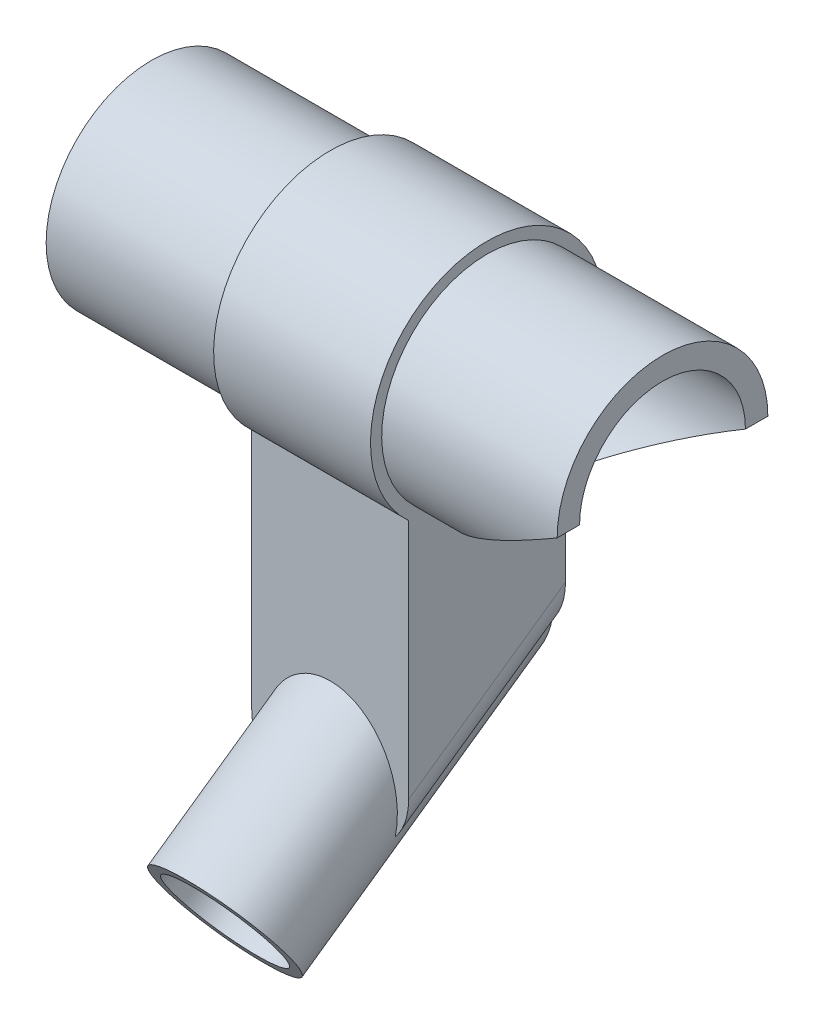
from build123d import *
from build123d.topology import SkipClean

# Parameters (mm, degrees)
CROQUIS1_R              = 23.5
CROQUIS1_R_2            = 18.5
SALIENTE_EXTRUIR1_DEPTH = 114
CROQUIS2_R              = 23.5
CROQUIS2_R_2            = 5.375
CROQUIS2_R_3            = 1.25
SALIENTE_EXTRUIR2_DEPTH = 5
CORTAR_EXTRUIR1_DEPTH   = 23.5
CROQUIS6_R              = 11.5
CORTAR_EXTRUIR2_DEPTH   = 2.5
CROQUIS17_W             = 35
CROQUIS17_H             = 35
SALIENTE_EXTRUIR3_DEPTH = 65
CROQUIS18_R             = 15
CROQUIS18_R_2           = 12.5
SALIENTE_EXTRUIR4_DEPTH = 70
CROQUIS26_W             = 35
CROQUIS26_H             = 35
SALIENTE_EXTRUIR8_DEPTH = 40
CORTAR_EXTRUIR4_DEPTH   = 167.48351172
REDONDEO1_R             = 10
CROQUIS27_R             = 26
SALIENTE_EXTRUIR9_DEPTH = 35
CORTAR_EXTRUIR7_START   = -35
CROQUIS28_R             = 18.5
CORTAR_EXTRUIR7_DEPTH   = 35
CROQUIS25_W             = 13.336801646
CROQUIS25_H             = 44.473979809
CORTAR_EXTRUIR8_DEPTH   = 35


with BuildPart() as part:
    # Croquis1 → Saliente-Extruir1 (new body)
    with BuildSketch(Plane(origin=(0, 0, 0), x_dir=(0, 0, -1), z_dir=(1, 0, 0))):
        with Locations(Location((0, 0, 0), (0, 0, 180))):
            Circle(CROQUIS1_R)
        with Locations(Location((0, 0, 0), (0, 0, 180))):
            Circle(CROQUIS1_R_2, mode=Mode.SUBTRACT)
    extrude(amount=SALIENTE_EXTRUIR1_DEPTH)

    # Croquis2 → Saliente-Extruir2 (add)
    with BuildSketch(Plane.ZY):
        Circle(CROQUIS2_R)
        Circle(CROQUIS2_R_2, mode=Mode.SUBTRACT)
        with Locations((-12.476232327, 6.351663319)):
            Circle(CROQUIS2_R_3, mode=Mode.SUBTRACT)
        with Locations((-6.351663319, -12.476232327)):
            Circle(CROQUIS2_R_3, mode=Mode.SUBTRACT)
        with Locations((12.476232327, -6.351663319)):
            Circle(CROQUIS2_R_3, mode=Mode.SUBTRACT)
        with Locations((6.351663319, 12.476232327)):
            Circle(CROQUIS2_R_3, mode=Mode.SUBTRACT)
    extrude(amount=-SALIENTE_EXTRUIR2_DEPTH)

    # Croquis4 → Cortar-Extruir1 (cut, symmetric)
    with BuildSketch(Plane.XY):
        Polygon((114, 0), (74, -23.5), (114, -23.5), align=None)
    extrude(amount=CORTAR_EXTRUIR1_DEPTH, both=True, mode=Mode.SUBTRACT)

    # Croquis6 → Cortar-Extruir2 (cut)
    with BuildSketch(Plane(origin=(5, 0, 0), x_dir=(0, 0, -1), z_dir=(1, 0, 0))):
        Circle(CROQUIS6_R)
    extrude(amount=-CORTAR_EXTRUIR2_DEPTH, mode=Mode.SUBTRACT)

    # Croquis17 → Saliente-Extruir3 (add)
    with BuildSketch(Plane(origin=(0, 0, 0), x_dir=(1, 0, 0), z_dir=(0, 1, 0))):
        with Locations((57.357864376, 0)):
            Rectangle(CROQUIS17_W, CROQUIS17_H)
    extrude(amount=-SALIENTE_EXTRUIR3_DEPTH)

    # Croquis18 → Saliente-Extruir4 (add)
    with BuildSketch(Plane(origin=(57.357864376, -93.678821818, 40.957602214), x_dir=(-1, 0, 0), z_dir=(3.885780586188049e-15, 0.5735764363510475, -0.8191520442889909))):
        with Locations(Location((0, 0, 0), (0, 0, 222.003230743))):
            Circle(CROQUIS18_R)
        with Locations(Location((0, 0, 0), (0, 0, 233.418217826))):
            Circle(CROQUIS18_R_2, mode=Mode.SUBTRACT)
    extrude(amount=SALIENTE_EXTRUIR4_DEPTH)

    # Croquis26 → Saliente-Extruir8 (add)
    with BuildSketch(Plane.XZ.offset(65)):
        with Locations((57.357864376, 0)):
            Rectangle(CROQUIS26_W, CROQUIS26_H)
    extrude(amount=SALIENTE_EXTRUIR8_DEPTH)

    # Croquis23 → Cortar-Extruir4 (cut, through all)
    with SkipClean():  # the faces are left unmerged after this step: merging them gives an invalid solid
        with BuildSketch(Plane(origin=(0, -50.063167159, 71.49761239), x_dir=(-0.9999999349220849, -0.00029552642887780036, -0.0002069298332451758), z_dir=(-3.88580769124236e-15, -0.5735764363510474, 0.819152044288991))):
            with BuildLine():
                Line((-72.338651426, 53.265572477), (-106.285107353, 53.265572477))
                ThreePointArc((-106.285107353, 53.265572477), (-57.338651426, 102.212028404), (-8.392195499, 53.265572477))
                Line((-8.392195499, 53.265572477), (-42.338651426, 53.265572477))
                ThreePointArc((-42.338651426, 53.265572477), (-57.338651426, 68.265572477), (-72.338651426, 53.265572477))
            make_face()
        extrude(amount=-CORTAR_EXTRUIR4_DEPTH, mode=Mode.SUBTRACT)

    # Chaflán1
    # the kernel refuses this chamfer: 5 mm, written as the material it adds along each edge
    with BuildSketch(Plane(origin=(72.3578634, -83.735162365, 26.766019567), x_dir=(0.9996237628252941, 0.0224682639001608, 0.015732447753382475), z_dir=(3.88580769124236e-15, 0.5735764363510474, -0.819152044288991))) as chafl_n1_piece_1_section:
        with BuildLine():
            Line((4.52468849, 0), (-0.739014204, 3.853882904))
            Line((-0.739014204, 3.853882904), (-0.835126609, 3.826271211))
            ThreePointArc((-0.835126609, 3.826271211), (-0.28053556, 1.941134087), (-0.099963359, -0.002706805))
            Line((-0.099963359, -0.002706805), (0.002706805, -0.099963359))
            ThreePointArc((0.002706805, -0.099963359), (2.263393477, -0.038748553), (4.527395295, -0.099963359))
            Line((4.527395295, -0.099963359), (4.52468849, 0))
        make_face()
    chafl_n1_piece_1 = extrude(amount=65.350553059, mode=Mode.PRIVATE)
    chafl_n1_piece_1 = split(chafl_n1_piece_1, bisect_by=Plane(origin=(74.857864376, -66.849730794, 0.212642444), z_dir=(-1, 0, 0)), keep=Keep.TOP, mode=Mode.PRIVATE)
    chafl_n1_piece_1 = split(chafl_n1_piece_1, bisect_by=Plane(origin=(73.269970471, -66.849730794, -17.5), z_dir=(0, 0, 1)), keep=Keep.TOP, mode=Mode.PRIVATE)
    chafl_n1_piece_1 = split(chafl_n1_piece_1, bisect_by=Plane(origin=(73.269970471, -66.849730794, 17.5), z_dir=(0, 0, -1)), keep=Keep.TOP, mode=Mode.PRIVATE)
    chafl_n1_piece_1 = split(chafl_n1_piece_1, bisect_by=Plane(origin=(73.269970471, -54.669749998, -17.182172852), z_dir=(-3.8857805861880495e-15, -0.5735764363510475, 0.8191520442889909)), keep=Keep.TOP, mode=Mode.PRIVATE)
    add(chafl_n1_piece_1)
    with BuildSketch(Plane(origin=(72.3578634, -83.735162365, 26.766019567), x_dir=(0.9996237628252941, 0.0224682639001608, 0.015732447753382475), z_dir=(3.88580769124236e-15, 0.5735764363510474, -0.819152044288991))) as chafl_n1_piece_2_section:
        with BuildLine():
            Line((4.52468849, 0), (-0.739014204, 3.853882904))
            Line((-0.739014204, 3.853882904), (-0.835126609, 3.826271211))
            ThreePointArc((-0.835126609, 3.826271211), (-0.28053556, 1.941134087), (-0.099963359, -0.002706805))
            Line((-0.099963359, -0.002706805), (0.002706805, -0.099963359))
            ThreePointArc((0.002706805, -0.099963359), (2.263393477, -0.038748553), (4.527395295, -0.099963359))
            Line((4.527395295, -0.099963359), (4.52468849, 0))
        make_face()
    chafl_n1_piece_2 = extrude(amount=65.350553059, mode=Mode.PRIVATE)
    chafl_n1_piece_2 = split(chafl_n1_piece_2, bisect_by=Plane(origin=(72.410675533, -56.139333536, -17.5), z_dir=(0, 0, -1)), keep=Keep.TOP, mode=Mode.PRIVATE)
    chafl_n1_piece_2 = split(chafl_n1_piece_2, bisect_by=Plane(origin=(72.410675533, -55.939365699, -18.071167337), z_dir=(-3.8857805861880495e-15, -0.5735764363510475, 0.8191520442889909)), keep=Keep.TOP, mode=Mode.PRIVATE)
    add(chafl_n1_piece_2)
    with BuildSketch(Plane(origin=(72.3578634, -83.735162365, 26.766019567), x_dir=(0.9996237628252941, 0.0224682639001608, 0.015732447753382475), z_dir=(3.88580769124236e-15, 0.5735764363510474, -0.819152044288991))) as chafl_n1_piece_3_section:
        with BuildLine():
            Line((4.52468849, 0), (-0.739014204, 3.853882904))
            Line((-0.739014204, 3.853882904), (-0.835126609, 3.826271211))
            ThreePointArc((-0.835126609, 3.826271211), (-0.28053556, 1.941134087), (-0.099963359, -0.002706805))
            Line((-0.099963359, -0.002706805), (0.002706805, -0.099963359))
            ThreePointArc((0.002706805, -0.099963359), (2.263393477, -0.038748553), (4.527395295, -0.099963359))
            Line((4.527395295, -0.099963359), (4.52468849, 0))
        make_face()
    chafl_n1_piece_3 = extrude(amount=65.350553059, mode=Mode.PRIVATE)
    chafl_n1_piece_3 = split(chafl_n1_piece_3, bisect_by=Plane(origin=(74.857864376, -53.732391069, -17.108811543), z_dir=(-1, 0, 0)), keep=Keep.TOP, mode=Mode.PRIVATE)
    chafl_n1_piece_3 = split(chafl_n1_piece_3, bisect_by=Plane(origin=(73.550293703, -53.732391069, -17.5), z_dir=(0, 0, 1)), keep=Keep.TOP, mode=Mode.PRIVATE)
    chafl_n1_piece_3 = split(chafl_n1_piece_3, bisect_by=Plane(origin=(73.550293703, -54.006304175, -16.717623086), z_dir=(3.8857805861880495e-15, 0.5735764363510475, -0.8191520442889909)), keep=Keep.TOP, mode=Mode.PRIVATE)
    add(chafl_n1_piece_3)
    with BuildSketch(Plane(origin=(42.357865352, -83.748374972, 26.766019567), x_dir=(0.1620303972007153, -0.8083275784914744, -0.5659970638025322), z_dir=(3.88580769124236e-15, 0.5735764363510474, -0.819152044288991))) as chafl_n1_piece_4_section:
        with BuildLine():
            Line((3.924099314, 0), (-0.852121415, 4.443725355))
            Line((-0.852121415, 4.443725355), (-0.950805831, 4.427557917))
            ThreePointArc((-0.950805831, 4.427557917), (-0.464313507, 2.215595733), (-0.098684416, -0.016167438))
            Line((-0.098684416, -0.016167438), (0.016167438, -0.098684416))
            ThreePointArc((0.016167438, -0.098684416), (1.959232583, 0.090052375), (3.915082265, -0.099592634))
            Line((3.915082265, -0.099592634), (3.924099314, 0))
        make_face()
    chafl_n1_piece_4 = extrude(amount=65.350553059, mode=Mode.PRIVATE)
    chafl_n1_piece_4 = split(chafl_n1_piece_4, bisect_by=Plane(origin=(41.446565804, -66.861949612, -17.5), z_dir=(0, 0, 1)), keep=Keep.TOP, mode=Mode.PRIVATE)
    chafl_n1_piece_4 = split(chafl_n1_piece_4, bisect_by=Plane(origin=(39.857864376, -66.861949612, 0.210272202), z_dir=(1, 0, 0)), keep=Keep.TOP, mode=Mode.PRIVATE)
    chafl_n1_piece_4 = split(chafl_n1_piece_4, bisect_by=Plane(origin=(41.446565804, -66.861949612, 17.5), z_dir=(0, 0, -1)), keep=Keep.TOP, mode=Mode.PRIVATE)
    chafl_n1_piece_4 = split(chafl_n1_piece_4, bisect_by=Plane(origin=(41.446565804, -54.679062597, -17.188693604), z_dir=(-3.8857805861880495e-15, -0.5735764363510475, 0.8191520442889909)), keep=Keep.TOP, mode=Mode.PRIVATE)
    add(chafl_n1_piece_4)
    with BuildSketch(Plane(origin=(42.357865352, -83.748374972, 26.766019567), x_dir=(0.1620303972007153, -0.8083275784914744, -0.5659970638025322), z_dir=(3.88580769124236e-15, 0.5735764363510474, -0.819152044288991))) as chafl_n1_piece_5_section:
        with BuildLine():
            Line((3.924099314, 0), (-0.852121415, 4.443725355))
            Line((-0.852121415, 4.443725355), (-0.950805831, 4.427557917))
            ThreePointArc((-0.950805831, 4.427557917), (-0.464313507, 2.215595733), (-0.098684416, -0.016167438))
            Line((-0.098684416, -0.016167438), (0.016167438, -0.098684416))
            ThreePointArc((0.016167438, -0.098684416), (1.959232583, 0.090052375), (3.915082265, -0.099592634))
            Line((3.915082265, -0.099592634), (3.924099314, 0))
        make_face()
    chafl_n1_piece_5 = extrude(amount=65.350553059, mode=Mode.PRIVATE)
    chafl_n1_piece_5 = split(chafl_n1_piece_5, bisect_by=Plane(origin=(41.165608091, -53.740671541, -17.5), z_dir=(0, 0, 1)), keep=Keep.TOP, mode=Mode.PRIVATE)
    chafl_n1_piece_5 = split(chafl_n1_piece_5, bisect_by=Plane(origin=(39.857864376, -53.740671541, -17.111139805), z_dir=(1, 0, 0)), keep=Keep.TOP, mode=Mode.PRIVATE)
    chafl_n1_piece_5 = split(chafl_n1_piece_5, bisect_by=Plane(origin=(41.165608091, -54.012954381, -16.72227961), z_dir=(3.8857805861880495e-15, 0.5735764363510475, -0.8191520442889909)), keep=Keep.TOP, mode=Mode.PRIVATE)
    add(chafl_n1_piece_5)
    with BuildSketch(Plane(origin=(42.357865352, -83.748374972, 26.766019567), x_dir=(0.1620303972007153, -0.8083275784914744, -0.5659970638025322), z_dir=(3.88580769124236e-15, 0.5735764363510474, -0.819152044288991))) as chafl_n1_piece_6_section:
        with BuildLine():
            Line((3.924099314, 0), (-0.852121415, 4.443725355))
            Line((-0.852121415, 4.443725355), (-0.950805831, 4.427557917))
            ThreePointArc((-0.950805831, 4.427557917), (-0.464313507, 2.215595733), (-0.098684416, -0.016167438))
            Line((-0.098684416, -0.016167438), (0.016167438, -0.098684416))
            ThreePointArc((0.016167438, -0.098684416), (1.959232583, 0.090052375), (3.915082265, -0.099592634))
            Line((3.915082265, -0.099592634), (3.924099314, 0))
        make_face()
    chafl_n1_piece_6 = extrude(amount=65.350553059, mode=Mode.PRIVATE)
    chafl_n1_piece_6 = split(chafl_n1_piece_6, bisect_by=Plane(origin=(42.302537866, -56.144513508, -17.5), z_dir=(0, 0, -1)), keep=Keep.TOP, mode=Mode.PRIVATE)
    chafl_n1_piece_6 = split(chafl_n1_piece_6, bisect_by=Plane(origin=(42.302537866, -55.943525833, -18.074080294), z_dir=(-3.8857805861880495e-15, -0.5735764363510475, 0.8191520442889909)), keep=Keep.TOP, mode=Mode.PRIVATE)
    add(chafl_n1_piece_6)

    # Redondeo1
    # the kernel refuses this fillet: 10 mm, written as the material it takes off along each edge
    with BuildSketch(Plane(origin=(74.857864376, -47.604392117, -27.351708624), x_dir=(-0.7903484372830198, -0.5018597340774087, -0.35140596892489034), z_dir=(0, -0.5735764363510114, 0.8191520442890161))) as redondeo1_piece_1:
        with BuildLine():
            CenterArc((4.95618085, -9.928694439), REDONDEO1_R, 96.846328464, 45.371756964)
            Line((-2.947303523, -3.802118334), (-3.10537321, -3.679586812))
            Line((-3.10537321, -3.679586812), (-0.158069687, 0.122531522))
            Line((-0.158069687, 0.122531522), (0, 0.2))
            ThreePointArc((0, 0.2), (1.882056296, 0.2), (3.740271227, 0.198573889))
            Line((3.740271227, 0.198573889), (3.764112592, 0))
        make_face()
    extrude(amount=66.780541695, mode=Mode.SUBTRACT)
    with BuildSketch(Plane(origin=(39.857864376, -85.928316508, 27.359920723), x_dir=(0.7907902899043229, -0.5013924657655409, -0.35107878413055366), z_dir=(0, 0.5735764363510112, -0.8191520442890163))) as redondeo1_piece_2:
        with BuildLine():
            CenterArc((4.960889033, -9.928286868), REDONDEO1_R, 96.86589021, 45.393536548)
            Line((-2.947013866, -3.807415056), (-3.105171924, -3.68499762))
            Line((-3.105171924, -3.68499762), (-0.158158058, 0.122417436))
            Line((-0.158158058, 0.122417436), (0, 0.2))
            ThreePointArc((0, 0.2), (1.882715511, 0.2), (3.741521861, 0.198565737))
            Line((3.741521861, 0.198565737), (3.765431021, 0))
        make_face()
    extrude(amount=66.800591939, mode=Mode.SUBTRACT)

    # Croquis27 → Saliente-Extruir9 (add)
    with BuildSketch(Plane.ZY.offset(-39.857864376)):
        Circle(CROQUIS27_R)
    extrude(amount=-SALIENTE_EXTRUIR9_DEPTH)

    # Croquis28 → Cortar-Extruir7 (cut)
    with BuildSketch(Plane(origin=(74.857864376, 0, 0), x_dir=(0, 0, -1), z_dir=(1, 0, 0)).offset(CORTAR_EXTRUIR7_START)):
        with Locations(Location((0, 0, 0), (0, 0, 180))):
            Circle(CROQUIS28_R)
    extrude(amount=CORTAR_EXTRUIR7_DEPTH, mode=Mode.SUBTRACT)

    # Croquis25 → Cortar-Extruir8 (cut)
    with BuildSketch(Plane.ZY.offset(-39.857864376)):
        with Locations((-24.168400823, -61.036222495)):
            Rectangle(CROQUIS25_W, CROQUIS25_H)
    extrude(amount=-CORTAR_EXTRUIR8_DEPTH, mode=Mode.SUBTRACT)


solid = part.part
